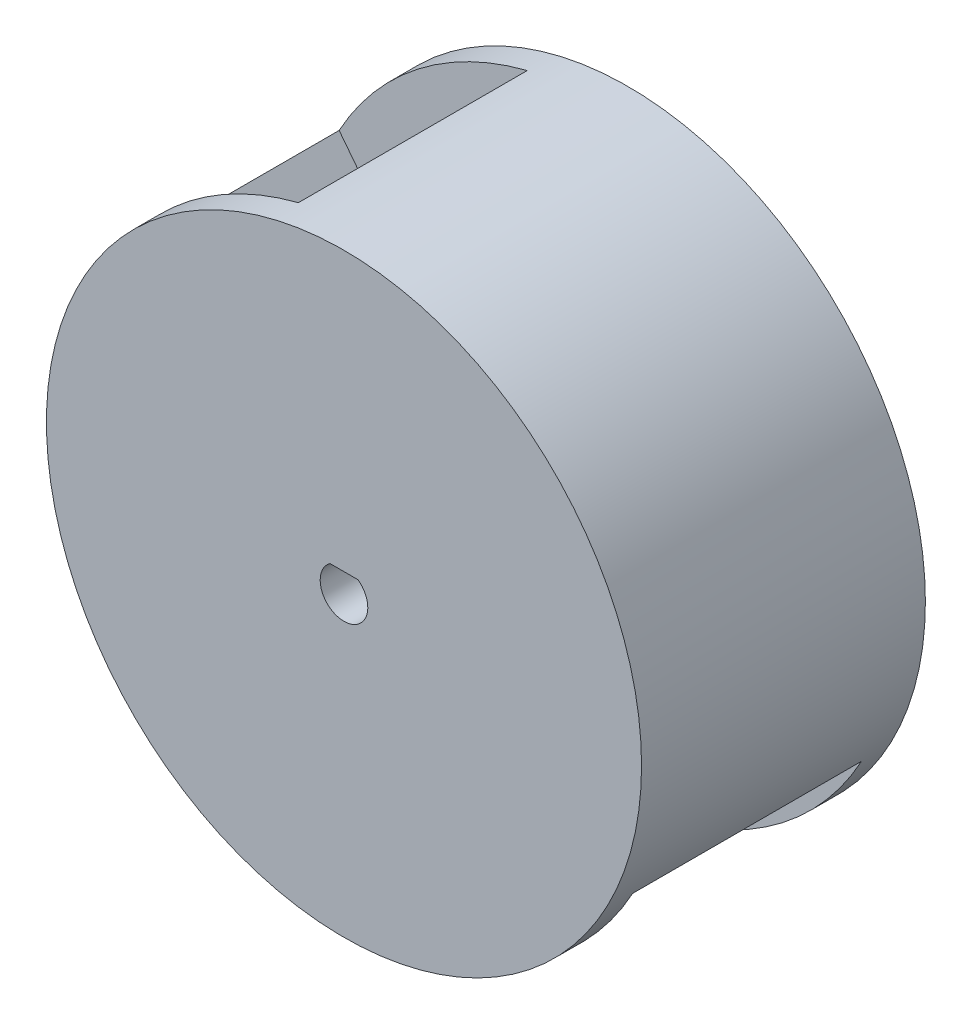
from build123d import *

# Parameters (mm, degrees)
SKETCH2_R           = 32.5
BOSS_EXTRUDE1_DEPTH = 3
BOSS_EXTRUDE2_DEPTH = 25
SKETCH4_R           = 32.5
BOSS_EXTRUDE3_DEPTH = 3
CUT_EXTRUDE1_DEPTH  = 56.439155838


with BuildPart() as part:
    # Sketch2 → Boss-Extrude1 (new body)
    with BuildSketch(Plane.XY):
        Circle(SKETCH2_R)
    extrude(amount=BOSS_EXTRUDE1_DEPTH)

    # Sketch3 → Boss-Extrude2 (add)
    with BuildSketch(Plane.XY.offset(3)):
        with BuildLine():
            Line((0, 7.5), (0, 21.210393848))
            Line((0, 21.210393848), (-7.984489127, 31.503935205))
            ThreePointArc((-7.984489127, 31.503935205), (-4.023189397, 32.250022435), (0, 32.5))
            ThreePointArc((0, 32.5), (25.680037902, 19.919479244), (31.478952737, -8.082421333))
            ThreePointArc((31.478952737, -8.082421333), (30.23630216, -11.917047944), (28.528519449, -15.56835181))
            Line((28.528519449, -15.56835181), (20.544030322, -5.274810453))
            Line((20.544030322, -5.274810453), (7.264373708, -1.865174154))
            ThreePointArc((7.264373708, -1.865174154), (4.596802902, -5.926162593), (0, -7.5))
            Line((0, -7.5), (0, -21.210393848))
            Line((0, -21.210393848), (7.984489127, -31.503935205))
            ThreePointArc((7.984489127, -31.503935205), (4.023189397, -32.250022435), (0, -32.5))
            ThreePointArc((0, -32.5), (-25.680037902, -19.919479244), (-31.478952737, 8.082421333))
            ThreePointArc((-31.478952737, 8.082421333), (-30.23630216, 11.917047944), (-28.528519449, 15.56835181))
            Line((-28.528519449, 15.56835181), (-20.544030322, 5.274810453))
            Line((-20.544030322, 5.274810453), (-7.264373708, 1.865174154))
            ThreePointArc((-7.264373708, 1.865174154), (-4.596802902, 5.926162593), (0, 7.5))
        make_face()
    extrude(amount=BOSS_EXTRUDE2_DEPTH)

    # Sketch4 → Boss-Extrude3 (add)
    with BuildSketch(Plane.XY.offset(28)):
        Circle(SKETCH4_R)
    extrude(amount=BOSS_EXTRUDE3_DEPTH)

    # Sketch5 → Cut-Extrude1 (cut, through all)
    with BuildSketch(Plane.XY.offset(31)):
        with BuildLine():
            Line((-1.532970972, 2.1), (1.532970972, 2.1))
            ThreePointArc((1.532970972, 2.1), (0, -2.6), (-1.532970972, 2.1))
        make_face()
    extrude(amount=-CUT_EXTRUDE1_DEPTH, mode=Mode.SUBTRACT)


solid = part.part
